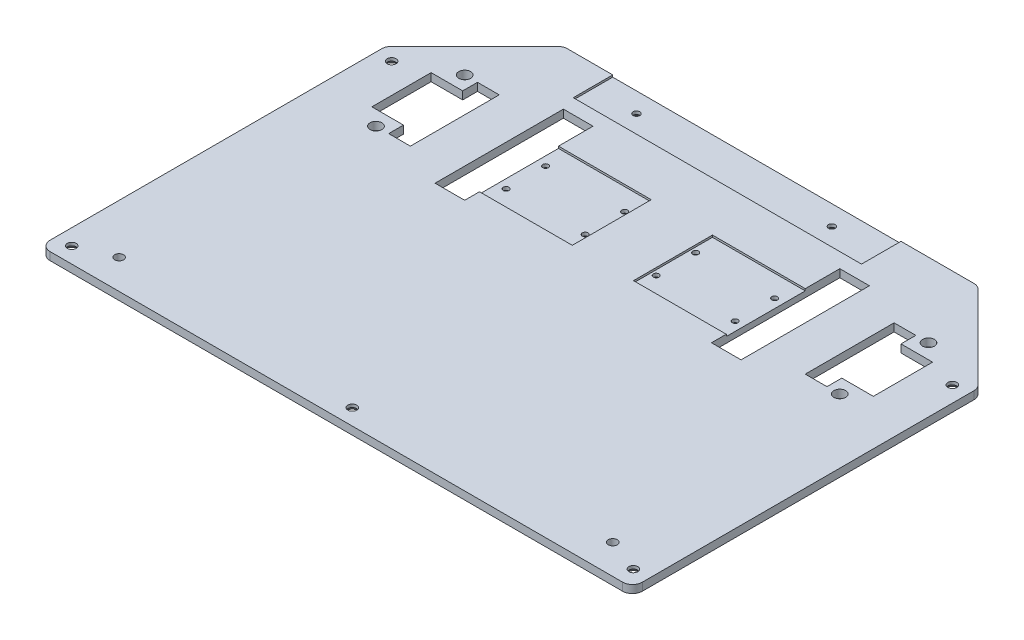
from build123d import *

# Parameters (mm, degrees)
MAIN_EXTRUSION_DEPTH                             = 4
CORNER_LEAVE_R                                   = 5
ESQUISSE2_R                                      = 3
ESQUISSE2_W                                      = 15
ESQUISSE2_H                                      = 65
ENL_V_MAT_EXTRU_1_DEPTH                          = 267.30058205
D_GAGEMENT_M41_D                                 = 4.5
ESQUISSE23_W                                     = 47
ESQUISSE23_H                                     = 40
ENL_V_MAT_EXTRU_2_DEPTH                          = 1
ESQUISSE24_R                                     = 1
ENL_V_MAT_EXTRU_3_DEPTH                          = 267.287438682
FRAISAGE_POUR_VIS_T_TE_FRAIS_E_M2_51_D           = 2.9
FRAISAGE_POUR_VIS_T_TE_FRAIS_E_M2_51_CSINK_D     = 5.5
FRAISAGE_POUR_VIS_T_TE_FRAIS_E_M2_51_CSINK_ANGLE = 90
FRAISAGE_POUR_VIS_T_TE_FRAIS_E_M41_AT_COUNT      = 2
FRAISAGE_POUR_VIS_T_TE_FRAIS_E_M41_AT_PITCH      = 142.035307944
FRAISAGE_POUR_VIS_T_TE_FRAIS_E_M41_2_COUNT       = 2
FRAISAGE_POUR_VIS_T_TE_FRAIS_E_M41_2_PITCH       = 284.035249862
FRAISAGE_POUR_VIS_T_TE_FRAIS_E_M41_3_COUNT       = 2
FRAISAGE_POUR_VIS_T_TE_FRAIS_E_M41_3_PITCH       = 326.770782266
FRAISAGE_POUR_VIS_T_TE_FRAIS_E_M41_4_COUNT       = 2
FRAISAGE_POUR_VIS_T_TE_FRAIS_E_M41_4_PITCH       = 161.565191978
ESQUISSE32_W                                     = 146
ESQUISSE32_H                                     = 20
ENL_V_MAT_EXTRU_4_DEPTH                          = 1
ESQUISSE33_R                                     = 1
ENL_V_MAT_EXTRU_5_DEPTH                          = 267.30058205
FRAISAGE_POUR_VIS_T_TE_FRAIS_E_M31_D             = 3.4
FRAISAGE_POUR_VIS_T_TE_FRAIS_E_M31_CSINK_D       = 6.3
FRAISAGE_POUR_VIS_T_TE_FRAIS_E_M31_CSINK_ANGLE   = 90


with BuildPart() as part:
    # Main scetch → Main extrusion (new body)
    with BuildSketch(Plane(origin=(0, 0, 0), x_dir=(1, 0, 0), z_dir=(0, 1, 0))):
        Polygon((-150, 0), (150, 0), (150, 175), (105, 220), (-105, 220), (-150, 175), align=None)
    extrude(amount=MAIN_EXTRUSION_DEPTH)

    # Corner leave
    corner_leave_edges = [part.edges().sort_by_distance(p)[0] for p in [
        (-150, 2, 0),
        (150, 2, -175),
        (105, 2, -220),
        (150, 2, 0),
        (-105, 2, -220),
        (-150, 2, -175),
    ]]
    fillet(corner_leave_edges, radius=CORNER_LEAVE_R)

    # Esquisse2 → Enlèv. mat.-Extru.1 (cut, through all)
    with BuildSketch(Plane(origin=(0, 4, 0), x_dir=(1, 0, 0), z_dir=(0, 1, 0))):
        with Locations((117.47, 182.47)):
            Circle(ESQUISSE2_R)
        with Locations((117.47, 137.53)):
            Circle(ESQUISSE2_R)
        with Locations((-117.47, 137.53)):
            Circle(ESQUISSE2_R)
        with Locations((-117.47, 182.47)):
            Circle(ESQUISSE2_R)
        with Locations((70, 160)):
            Rectangle(ESQUISSE2_W, ESQUISSE2_H)
        Polygon((100, 137.5), (100, 182.5), (111, 182.5), (111, 175), (127, 175), (127, 145), (111, 145), (111, 137.5), align=None)
        Polygon((-111, 137.5), (-111, 145), (-127, 145), (-127, 175), (-111, 175), (-111, 182.5), (-100, 182.5), (-100, 137.5), align=None)
        with Locations((-70, 160)):
            Rectangle(ESQUISSE2_W, ESQUISSE2_H)
    extrude(amount=-ENL_V_MAT_EXTRU_1_DEPTH, mode=Mode.SUBTRACT)

    # Dégagement M41 (through all)
    with Locations(Plane(origin=(0, 4, 0), x_dir=(1, 0, 0), z_dir=(0, 1, 0))):
        with Locations((-125, 15), (125, 15)):
            Hole(D_GAGEMENT_M41_D / 2)

    # Esquisse23 → Enlèv. mat.-Extru.2 (cut)
    with BuildSketch(Plane(origin=(0, 4, 0), x_dir=(1, 0, 0), z_dir=(0, 1, 0))):
        with Locations((-39, 155)):
            Rectangle(ESQUISSE23_W, ESQUISSE23_H)
    enl_v_mat_extru_2 = extrude(amount=-ENL_V_MAT_EXTRU_2_DEPTH, mode=Mode.SUBTRACT)

    # Esquisse24 → Enlèv. mat.-Extru.3 (cut, through all)
    with BuildSketch(Plane(origin=(0, 3, 0), x_dir=(1, 0, 0), z_dir=(0, 1, 0))):
        with Locations((-58, 164)):
            Circle(ESQUISSE24_R)
        with Locations((-58, 144)):
            Circle(ESQUISSE24_R)
        with Locations((-18, 164)):
            Circle(ESQUISSE24_R)
        with Locations((-18, 144)):
            Circle(ESQUISSE24_R)
    enl_v_mat_extru_3 = extrude(amount=-ENL_V_MAT_EXTRU_3_DEPTH, mode=Mode.SUBTRACT)

    # Fraisage pour vis à tête fraisée M2.51 (through all)
    with Locations(Plane(origin=(0, 0, 0), x_dir=(-1, 0, 0), z_dir=(0, -1, 0))):
        with Locations((18, 164), (58, 164), (58, 144), (18, 144)):
            fraisage_pour_vis_t_te_frais_e_m2_51 = CounterSinkHole(FRAISAGE_POUR_VIS_T_TE_FRAIS_E_M2_51_D / 2, FRAISAGE_POUR_VIS_T_TE_FRAIS_E_M2_51_CSINK_D / 2, counter_sink_angle=FRAISAGE_POUR_VIS_T_TE_FRAIS_E_M2_51_CSINK_ANGLE)

    # Symétrie1: Enlèv. mat.-Extru.2, Enlèv. mat.-Extru.3, Fraisage pour vis à tête fraisée M2.51 across plane
    add(enl_v_mat_extru_2.mirror(Plane(origin=(0, 0, 0), x_dir=(0, 0, 1), z_dir=(1, 0, 0))), mode=Mode.SUBTRACT)
    add(enl_v_mat_extru_3.mirror(Plane(origin=(0, 0, 0), x_dir=(0, 0, 1), z_dir=(1, 0, 0))), mode=Mode.SUBTRACT)
    add(fraisage_pour_vis_t_te_frais_e_m2_51.mirror(Plane(origin=(0, 0, 0), x_dir=(0, 0, 1), z_dir=(1, 0, 0))), mode=Mode.SUBTRACT)

    # Esquisse31 → Fraisage pour vis à tête fraisée M41 (revolve, cut)
    with BuildSketch(Plane(origin=(142.034917049, 0, -8.434811795), x_dir=(0, 0, -1), z_dir=(1, 0, 0))):
        Polygon((0, 0), (0, 4), (2.25, 4), (2.25, 2.45), (4.7, 0), align=None)
    fraisage_pour_vis_t_te_frais_e_m41 = revolve(axis=Axis((142.034917049, -6.35, -8.434811795), (0, 1, 0)), mode=Mode.SUBTRACT)

    # Fraisage pour vis à tête fraisée M41 at: Fraisage pour vis à tête fraisée M41 ×2
    with Locations(*[Vector(-0.9999972478981508, 0, 0.002346102326084912) * (i * FRAISAGE_POUR_VIS_T_TE_FRAIS_E_M41_AT_PITCH) for i in range(1, FRAISAGE_POUR_VIS_T_TE_FRAIS_E_M41_AT_COUNT)]):
        add(fraisage_pour_vis_t_te_frais_e_m41, mode=Mode.SUBTRACT)

    # Fraisage pour vis _ t_te frais_e M41 2: Fraisage pour vis à tête fraisée M41 ×2
    with Locations(*[Vector(-0.9999988282676796, 0, 0.0015308374400840067) * (i * FRAISAGE_POUR_VIS_T_TE_FRAIS_E_M41_2_PITCH) for i in range(1, FRAISAGE_POUR_VIS_T_TE_FRAIS_E_M41_2_COUNT)]):
        add(fraisage_pour_vis_t_te_frais_e_m41, mode=Mode.SUBTRACT)

    # Fraisage pour vis _ t_te frais_e M41 3: Fraisage pour vis à tête fraisée M41 ×2
    with Locations(*[Vector(-0.8692176059291576, 0, -0.4944297255857335) * (i * FRAISAGE_POUR_VIS_T_TE_FRAIS_E_M41_3_PITCH) for i in range(1, FRAISAGE_POUR_VIS_T_TE_FRAIS_E_M41_3_COUNT)]):
        add(fraisage_pour_vis_t_te_frais_e_m41, mode=Mode.SUBTRACT)

    # Fraisage pour vis _ t_te frais_e M41 4: Fraisage pour vis à tête fraisée M41 ×2
    with Locations(*[Vector(-0.00021611739763843655, 0, -0.999999976646635) * (i * FRAISAGE_POUR_VIS_T_TE_FRAIS_E_M41_4_PITCH) for i in range(1, FRAISAGE_POUR_VIS_T_TE_FRAIS_E_M41_4_COUNT)]):
        add(fraisage_pour_vis_t_te_frais_e_m41, mode=Mode.SUBTRACT)

    # Esquisse32 → Enlèv. mat.-Extru.4 (cut)
    with BuildSketch(Plane(origin=(0, 4, 0), x_dir=(1, 0, 0), z_dir=(0, 1, 0))):
        with Locations((-7, 210)):
            Rectangle(ESQUISSE32_W, ESQUISSE32_H)
    extrude(amount=-ENL_V_MAT_EXTRU_4_DEPTH, mode=Mode.SUBTRACT)

    # Esquisse33 → Enlèv. mat.-Extru.5 (cut, through all)
    with BuildSketch(Plane.XZ):
        with Locations((-58, -210)):
            Circle(ESQUISSE33_R)
        with Locations((41, -210)):
            Circle(ESQUISSE33_R)
    extrude(amount=-ENL_V_MAT_EXTRU_5_DEPTH, mode=Mode.SUBTRACT)

    # Fraisage pour vis à tête fraisée M31 (through all)
    with Locations(Plane(origin=(0, 0, 0), x_dir=(-1, 0, 0), z_dir=(0, -1, 0))):
        with Locations((58, 210), (-41, 210)):
            CounterSinkHole(FRAISAGE_POUR_VIS_T_TE_FRAIS_E_M31_D / 2, FRAISAGE_POUR_VIS_T_TE_FRAIS_E_M31_CSINK_D / 2, counter_sink_angle=FRAISAGE_POUR_VIS_T_TE_FRAIS_E_M31_CSINK_ANGLE)


solid = part.part
